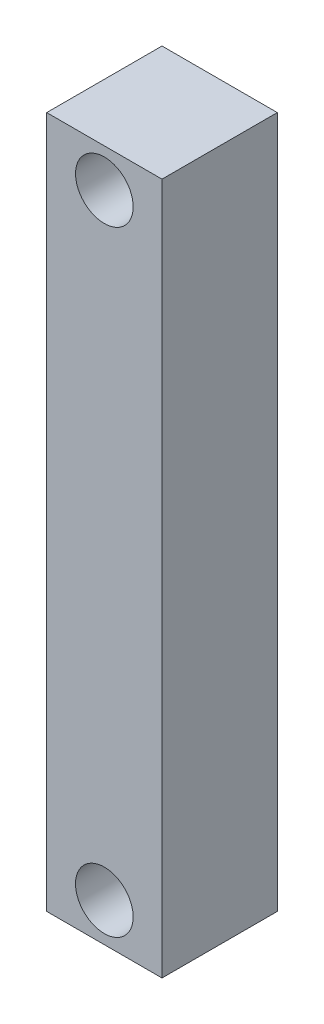
from build123d import *

# Parameters (mm, degrees)
SKETCH_1_W          = 6
SKETCH_1_H          = 36
EXTRUDE_1_DEPTH     = 6
SKETCH_2_R          = 1.5
CUT_EXTRUDE_1_DEPTH = 6


with BuildPart() as part:
    # 草图1 → 凸台-拉伸1 (new body)
    with BuildSketch(Plane.XY):
        Rectangle(SKETCH_1_W, SKETCH_1_H)
    extrude(amount=EXTRUDE_1_DEPTH)

    # 草图2 → 切除-拉伸1 (cut)
    with BuildSketch(Plane.XY.offset(6)):
        with Locations((0, 16)):
            Circle(SKETCH_2_R)
        with Locations((0, -16)):
            Circle(SKETCH_2_R)
    extrude(amount=-CUT_EXTRUDE_1_DEPTH, mode=Mode.SUBTRACT)


solid = part.part
